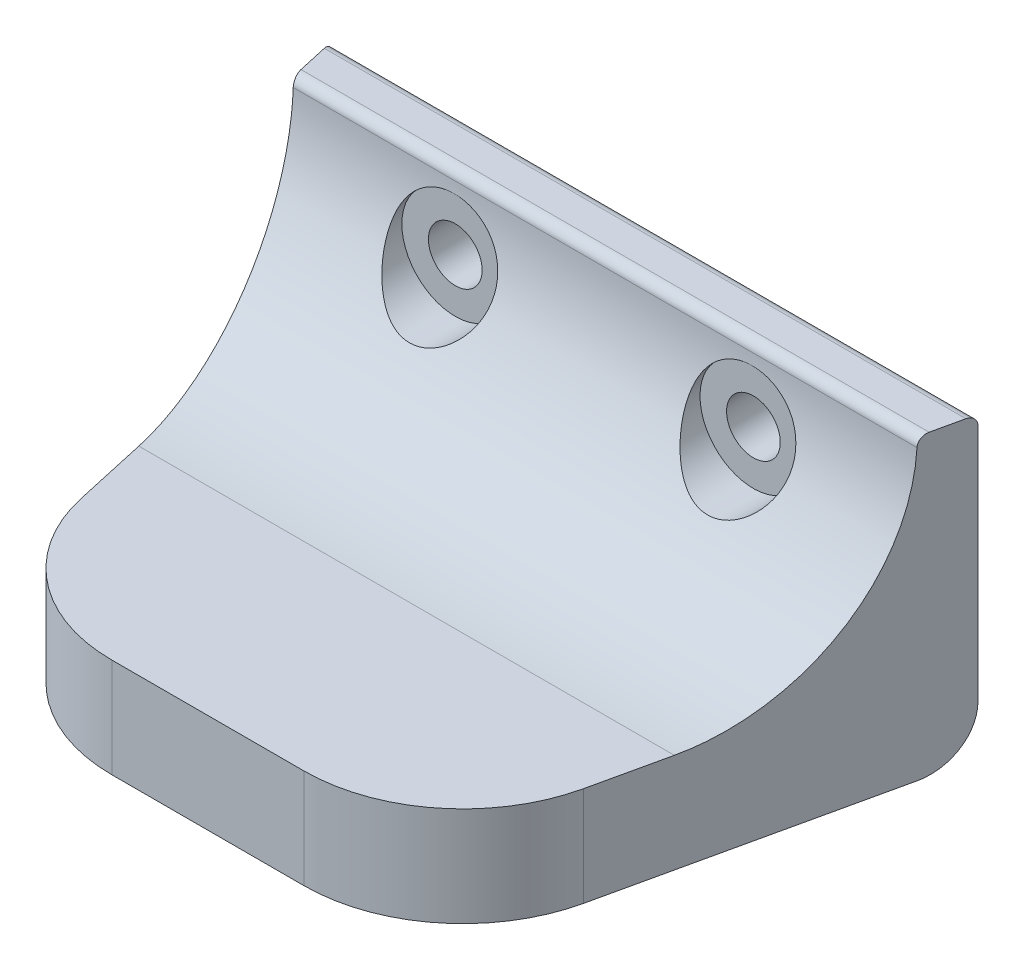
from build123d import *

# Parameters (mm, degrees)
BOSS_EXTRUDE1_DEPTH = 12.7
BOSS_EXTRUDE2_DEPTH = 38.1
FILLET1_R           = 25.4
FILLET2_R           = 20.32
FILLET3_R           = 6.35
FILLET4_R           = 1.2699999999999994
CUT_EXTRUDE1_DEPTH  = 38.1
SKETCH5_R           = 6.826249999999999
SKETCH5_R_2         = 6.826250000000001
CUT_EXTRUDE4_DEPTH  = 20.32


with BuildPart() as part:
    # Sketch1 → Boss-Extrude1 (new body)
    with BuildSketch(Plane(origin=(0, 0, 0), x_dir=(1, 0, 0), z_dir=(0, 1, 0))):
        Polygon((39.86388888888888, 22.225000000000012), (-39.86388888888888, 22.225), (-28.574999999999996, -28.57499999999998), (28.575000000000006, -28.574999999999978), align=None)
        Polygon((41.27499999999999, 28.575000000000014), (-41.275000000000006, 28.575000000000003), (-39.863888888888894, 22.225), (39.86388888888888, 22.225000000000012), align=None)
    extrude(amount=BOSS_EXTRUDE1_DEPTH)

    # Sketch1<5> → Boss-Extrude2 (add)
    with BuildSketch(Plane(origin=(0, 0, 0), x_dir=(1, 0, 0), z_dir=(0, 1, 0))):
        Polygon((41.27499999999999, 28.575000000000014), (-41.275000000000006, 28.575000000000003), (-39.863888888888894, 22.225), (39.86388888888888, 22.225000000000012), align=None)
    extrude(amount=BOSS_EXTRUDE2_DEPTH)

    # Fillet1
    fillet1_edges = [part.edges().sort_by_distance(p)[0] for p in [
        (0, 12.7, -22.22500000000001),
    ]]
    fillet(fillet1_edges, radius=FILLET1_R - 0.0001)  # a hair under: the kernel refuses the full size

    # Fillet2
    fillet2_edges = [part.edges().sort_by_distance(p)[0] for p in [
        (28.575000000000006, 6.35, 28.574999999999978),
        (-28.574999999999996, 6.35, 28.57499999999998),
    ]]
    fillet(fillet2_edges, radius=FILLET2_R)

    # Fillet3
    fillet3_edges = [part.edges().sort_by_distance(p)[0] for p in [
        (-7.11e-15, 0, -28.57500000000001),
    ]]
    fillet(fillet3_edges, radius=FILLET3_R)

    # Fillet4
    fillet4_edges = [part.edges().sort_by_distance(p)[0] for p in [
        (0, 38.1, -22.22500000000001),
        (-7.11e-15, 38.1, -28.57500000000001),
    ]]
    fillet(fillet4_edges, radius=FILLET4_R)

    # Sketch4 → Cut-Extrude1 (cut)
    with BuildSketch(Plane(origin=(-3.6e-15, 0, -28.57500000000001), x_dir=(-1, 0, 1.3e-16), z_dir=(-1.3e-16, 0, -1))):
        with BuildLine():
            ThreePointArc((-22.35199999999955, 28.703096211960737), (-18.92299999999955, 25.27409621196074), (-15.493999999999552, 28.703096211960737))
            Line((-15.493999999999552, 28.70309621196053), (-22.35199999999955, 28.70309621196053))
        make_face()
        with BuildLine():
            Line((-22.35199999999955, 28.70309621196053), (-15.493999999999552, 28.70309621196053))
            ThreePointArc((-15.493999999999552, 28.703096211960737), (-18.92299999999955, 32.132096211960736), (-22.35199999999955, 28.703096211960737))
        make_face()
        with BuildLine():
            ThreePointArc((15.748000000000676, 28.70309621196054), (19.177000000000678, 25.274096211960536), (22.60600000000068, 28.70309621196054))
            Line((22.60600000000068, 28.703096211960535), (15.748000000000676, 28.703096211960535))
        make_face()
        with BuildLine():
            Line((15.748000000000676, 28.703096211960535), (22.60600000000068, 28.703096211960535))
            ThreePointArc((22.60600000000068, 28.70309621196054), (19.177000000000678, 32.132096211960544), (15.748000000000676, 28.70309621196054))
        make_face()
    extrude(amount=-CUT_EXTRUDE1_DEPTH, mode=Mode.SUBTRACT)

    # Sketch5 → Cut-Extrude4 (cut)
    with BuildSketch(Plane(origin=(-2.8e-15, 0, -22.22500000000001), x_dir=(-1, 0, 1.3e-16), z_dir=(-1.3e-16, 0, -1))):
        with Locations((-18.92299999999955, 28.703096211960737)):
            Circle(SKETCH5_R)
        with Locations((19.177000000000678, 28.70309621196054)):
            Circle(SKETCH5_R_2)
    extrude(amount=-CUT_EXTRUDE4_DEPTH, mode=Mode.SUBTRACT)


solid = part.part
